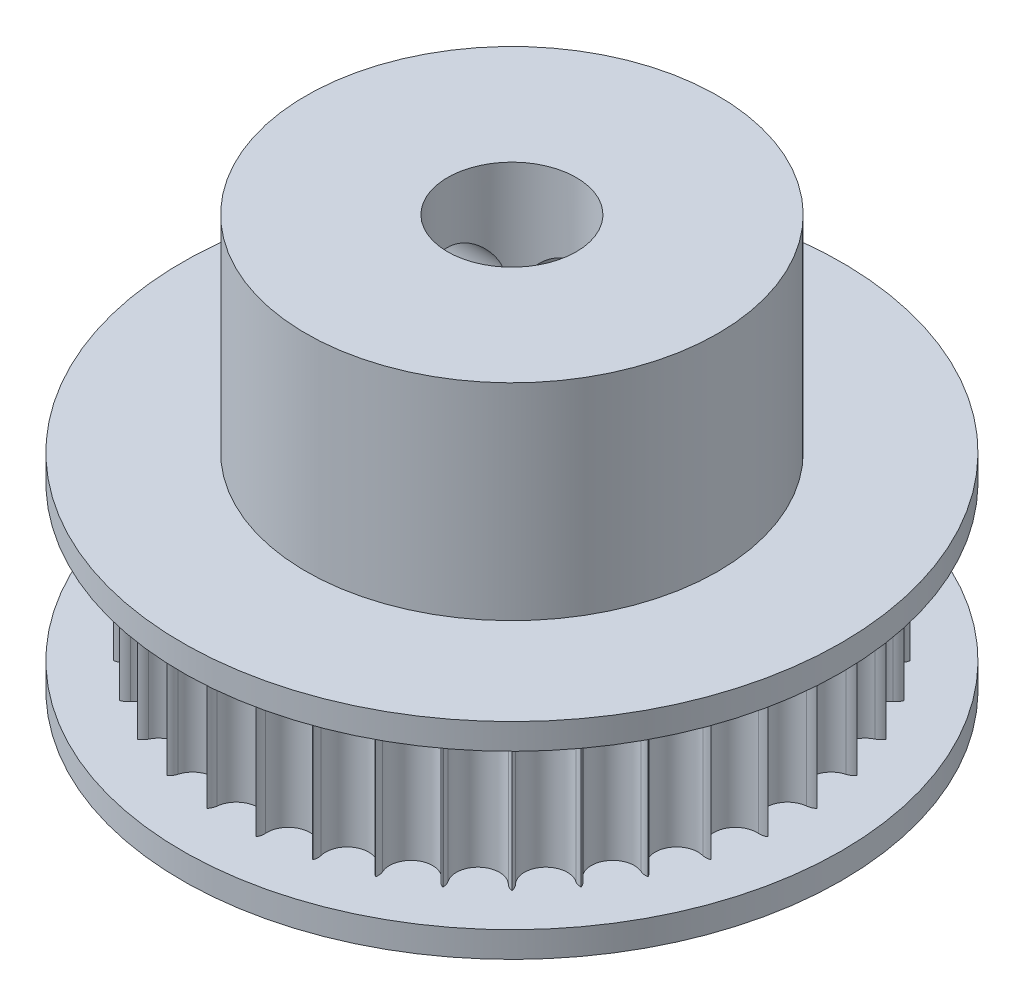
from build123d import *

# Parameters (mm, degrees)
CUT_EXTRUDE1_DEPTH      = 6
CIRPATTERN1_COUNT       = 36
CUT_EXTRUDE2_REACH      = 21.998
CUT_EXTRUDE2_END_RADIUS = 8
SKETCH3_R               = 1.65
CUT_EXTRUDE3_REACH      = 21.998
CUT_EXTRUDE3_END_RADIUS = 8
SKETCH4_R               = 1.65
CHAMFER1_SIZE           = 1


with BuildPart() as part:
    # Skica2 → Revolute (revolve)
    with BuildSketch(Plane.XY):
        Polygon((8, 8.5), (2.5, 8.5), (2.5, -8.5), (6.11, -8.5), (6.11, -7.5), (12.8, -7.5), (12.8, -6.5), (11.15, -6.5), (11.15, -0.5), (12.8, -0.5), (12.8, 0.5), (8, 0.5), align=None)
    revolve(axis=Axis((0, -8.5, 0), (0, 1, 0)))

    # Sketch2 → Cut-Extrude1 (cut)
    with BuildSketch(Plane.XZ.offset(0.5)):
        with BuildLine():
            ThreePointArc((-0.831661365, 10.617478014), (0, 9.866329289), (0.831661365, 10.617478014))
            ThreePointArc((0.831661365, 10.617478014), (1.017799005, 10.958027157), (1.391478752, 11.062833583))
            ThreePointArc((1.391478752, 11.062833583), (1.776250939, 11.007607942), (2.1588643, 10.939003837))
            ThreePointArc((2.1588643, 10.939003837), (1.553174348, 12.383882602), (0, 12.589271032))
            ThreePointArc((0, 12.589271032), (-1.553174348, 12.383882602), (-2.1588643, 10.939003837))
            ThreePointArc((-2.1588643, 10.939003837), (-1.776250939, 11.007607942), (-1.391478752, 11.062833583))
            ThreePointArc((-1.391478752, 11.062833583), (-1.017799005, 10.958027157), (-0.831661365, 10.617478014))
        make_face()
    cut_extrude1 = extrude(amount=CUT_EXTRUDE1_DEPTH, mode=Mode.SUBTRACT)

    # CirPattern1: Cut-Extrude1 ×36 about axis
    cirpattern1_axis = Axis((0, 0, 0), (0, 1, 0))
    for i in range(1, CIRPATTERN1_COUNT):
        add(cut_extrude1.rotate(cirpattern1_axis, i * 360 / CIRPATTERN1_COUNT), mode=Mode.SUBTRACT)

    # Cut-Extrude2: up to this cylinder (the profile starts inside it)
    cut_extrude2_end = Plane(origin=(0, 4.5, 0), z_dir=(0, -1, 0)) * Cylinder(CUT_EXTRUDE2_END_RADIUS, 60.996, mode=Mode.PRIVATE)
    # Sketch3 → Cut-Extrude2 (cut, up to the surface)
    with BuildSketch(Plane(origin=(0, 0, 0), x_dir=(0, 0, -1), z_dir=(1, 0, 0)), mode=Mode.PRIVATE) as cut_extrude2_sk1:
        with Locations((0, 4.5)):
            Circle(SKETCH3_R)
    cut_extrude2_tool1 = extrude(cut_extrude2_sk1.sketch, amount=-CUT_EXTRUDE2_REACH, mode=Mode.PRIVATE) & cut_extrude2_end
    add(cut_extrude2_tool1.solids().sort_by_distance((0, 4.5, 0))[0], mode=Mode.SUBTRACT)

    # Cut-Extrude3: up to this cylinder (the profile starts inside it)
    cut_extrude3_end = Plane(origin=(0, 4, 0), z_dir=(0, -1, 0)) * Cylinder(CUT_EXTRUDE3_END_RADIUS, 60.996, mode=Mode.PRIVATE)
    # Sketch4 → Cut-Extrude3 (cut, up to the surface)
    with BuildSketch(Plane.XY, mode=Mode.PRIVATE) as cut_extrude3_sk1:
        with Locations((0, 4)):
            Circle(SKETCH4_R)
    cut_extrude3_tool1 = extrude(cut_extrude3_sk1.sketch, amount=-CUT_EXTRUDE3_REACH, mode=Mode.PRIVATE) & cut_extrude3_end
    add(cut_extrude3_tool1.solids().sort_by_distance((0, 4, 0))[0], mode=Mode.SUBTRACT)

    # Chamfer1
    chamfer1_edges = [part.edges().sort_by_distance(p)[0] for p in [
        (-6.11, -7.5, 0),
    ]]
    chamfer(chamfer1_edges, length=CHAMFER1_SIZE - 0.0001)  # a hair under: the kernel refuses the full size


solid = part.part
